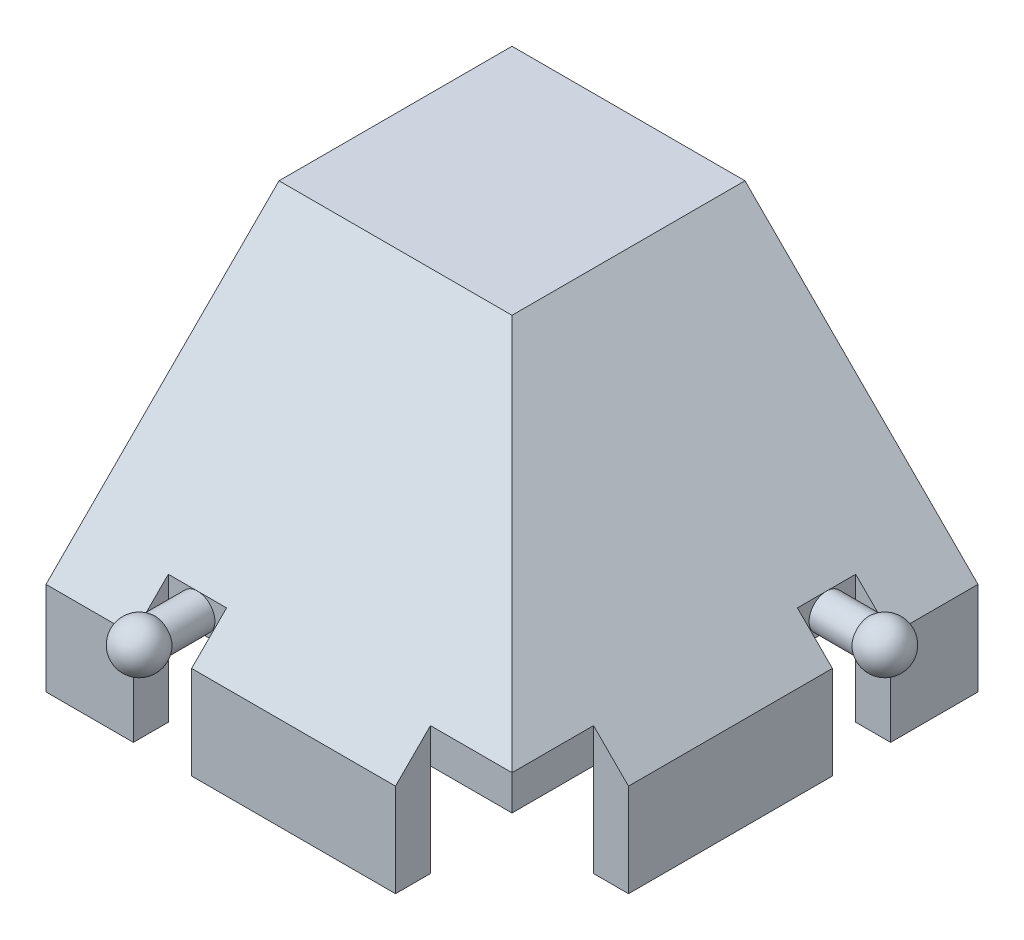
from build123d import *

# Parameters (mm, degrees)
SKETCH1_W           = 40
SKETCH1_H           = 40
BOSS_EXTRUDE1_DEPTH = 20
CHAMFER1_SIZE       = 20
SKETCH2_W           = 3
SKETCH2_H           = 5
SKETCH2_W_2         = 5
SKETCH2_H_2         = 3
CUT_EXTRUDE1_DEPTH  = 20
SKETCH3_W           = 17.5
SKETCH3_H           = 3
SKETCH3_W_2         = 3
SKETCH3_H_2         = 17.5
SKETCH3_H_3         = 7.5
SKETCH3_W_3         = 7.5
BOSS_EXTRUDE2_DEPTH = 8
SKETCH4_R           = 1.5
BOSS_EXTRUDE3_DEPTH = 5
SKETCH6_R           = 1.5
BOSS_EXTRUDE4_DEPTH = 5


with BuildPart() as part:
    # Sketch1 → Boss-Extrude1 (new body)
    with BuildSketch(Plane(origin=(0, 0, 0), x_dir=(1, 0, 0), z_dir=(0, 1, 0))):
        with Locations((-1.65921027, -4.12371134)):
            Rectangle(SKETCH1_W, SKETCH1_H)
    extrude(amount=BOSS_EXTRUDE1_DEPTH)

    # Chamfer1
    chamfer1_edges = [part.edges().sort_by_distance(p)[0] for p in [
        (18.34078973, 20, 4.12371134),
        (-1.65921027, 20, 24.12371134),
    ]]
    chamfer(chamfer1_edges, length=CHAMFER1_SIZE - 0.0001)  # a hair under: the kernel refuses the full size

    # Sketch2 → Cut-Extrude1 (cut)
    with BuildSketch(Plane.XZ):
        Polygon((15.34078973, 21.12371134), (15.34078973, 14.12371134), (18.34078973, 14.12371134), (18.34078973, 24.12371134), (8.34078973, 24.12371134), (8.34078973, 21.12371134), align=None)
        with Locations((16.84078973, -5.87628866)):
            Rectangle(SKETCH2_W, SKETCH2_H)
        with Locations((-11.65921027, 22.62371134)):
            Rectangle(SKETCH2_W_2, SKETCH2_H_2)
    extrude(amount=-CUT_EXTRUDE1_DEPTH, mode=Mode.SUBTRACT)

    # Sketch3 → Boss-Extrude2 (add)
    with BuildSketch(Plane.XZ):
        with Locations((-0.40921027, 22.62371134)):
            Rectangle(SKETCH3_W, SKETCH3_H)
        with Locations((16.84078973, 5.37371134)):
            Rectangle(SKETCH3_W_2, SKETCH3_H_2)
        with Locations((16.84078973, -12.12628866)):
            Rectangle(SKETCH3_W_2, SKETCH3_H_3)
        with Locations((-17.90921027, 22.62371134)):
            Rectangle(SKETCH3_W_3, SKETCH3_H)
    extrude(amount=BOSS_EXTRUDE2_DEPTH)

    # Sketch4 → Boss-Extrude3 (add)
    with BuildSketch(Plane.XY.offset(21.12371134)):
        with Locations(Location((-11.65921027, 1.5, 0), (0, 0, 270))):
            Circle(SKETCH4_R)
    extrude(amount=BOSS_EXTRUDE3_DEPTH)

    # Sketch5 → Revolve1 (revolve)
    with BuildSketch(Plane.XY.offset(26.12371134)):
        with BuildLine():
            Line((-11.65921027, 3.5), (-11.65921027, -0.5))
            ThreePointArc((-11.65921027, -0.5), (-9.65921027, 1.5), (-11.65921027, 3.5))
        make_face()
    revolve(axis=Axis((-11.65921027, 3.5, 26.12371134), (0, -1, 0)))

    # Sketch6 → Boss-Extrude4 (add)
    with BuildSketch(Plane(origin=(15.34078973, 0, 0), x_dir=(0, 0, -1), z_dir=(1, 0, 0))):
        with Locations(Location((5.87628866, 1.5, 0), (0, 0, 270))):
            Circle(SKETCH6_R)
    extrude(amount=BOSS_EXTRUDE4_DEPTH)

    # Sketch7 → Revolve2 (revolve)
    with BuildSketch(Plane(origin=(20.34078973, 0, 0), x_dir=(0, 0, -1), z_dir=(1, 0, 0))):
        with BuildLine():
            Line((5.87628866, 3.5), (5.87628866, -0.5))
            ThreePointArc((5.87628866, -0.5), (3.87628866, 1.5), (5.87628866, 3.5))
        make_face()
    revolve(axis=Axis((20.34078973, 3.5, -5.87628866), (0, -1, 0)))


solid = part.part
